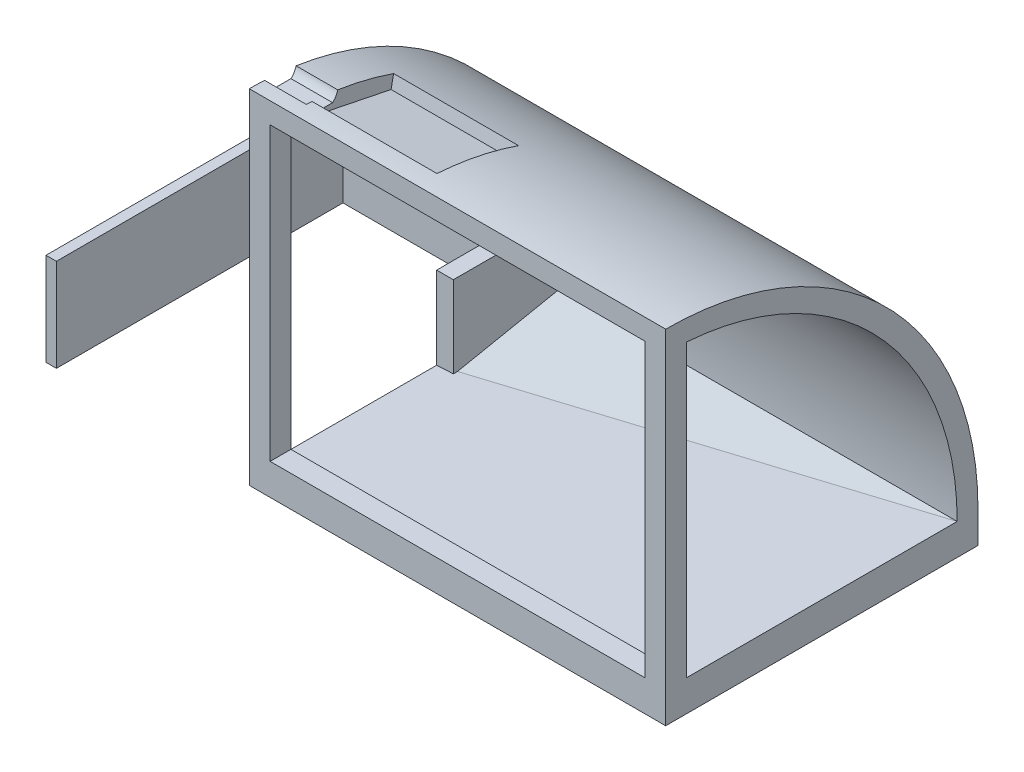
from build123d import *

# Parameters (mm, degrees)
SKETCH1_W                = 200
SKETCH1_H                = 150
BOSS_EXTRUDE1_DEPTH      = 15
SKETCH1_5_W              = 200
SKETCH1_5_H              = 10
REVOLVE1_ANGLE           = 90
BOSS_EXTRUDE3_REACH      = 197.256
BOSS_EXTRUDE3_END_RADIUS = 140
SKETCH1_6_W              = 10
SKETCH1_6_H              = 10
CUT_EXTRUDE2_DEPTH       = 60
CUT_EXTRUDE3_DEPTH       = 20
CUT_LOFT8_START          = -65
CUT_LOFT8_DEPTH          = 130
CUT_LOFT8_START_2        = -100
CUT_LOFT8_2_DEPTH        = 200
BOSS_EXTRUDE5_DEPTH      = 100
BOSS_EXTRUDE6_START      = -8
BOSS_EXTRUDE6_DEPTH      = 8
BOSS_EXTRUDE7_START      = -5
BOSS_EXTRUDE7_DEPTH      = 5


with BuildPart() as part:
    # Sketch1 → Boss-Extrude1 (new body)
    with BuildSketch(Plane(origin=(0, 0, 0), x_dir=(1, 0, 0), z_dir=(0, 1, 0))):
        Rectangle(SKETCH1_W, SKETCH1_H)
    extrude(amount=-BOSS_EXTRUDE1_DEPTH)

    # Sketch1<5> → Revolve1 (revolve)
    with BuildSketch(Plane(origin=(0, 0, 0), x_dir=(1, 0, 0), z_dir=(0, 1, 0))):
        with Locations((0, 70)):
            Rectangle(SKETCH1_5_W, SKETCH1_5_H)
    revolve(axis=Axis((-100, 0, 75), (1, 0, 0)), revolution_arc=REVOLVE1_ANGLE)

    # Boss-Extrude3: up to this cylinder (the profile starts inside it)
    boss_extrude3_end = Plane(origin=(0, 0, 75), z_dir=(-1, 0, 0)) * Cylinder(BOSS_EXTRUDE3_END_RADIUS, 865.512, mode=Mode.PRIVATE)
    # Sketch1<6> → Boss-Extrude3 (add, up to the surface)
    with BuildSketch(Plane(origin=(0, 0, 0), x_dir=(1, 0, 0), z_dir=(0, 1, 0)), mode=Mode.PRIVATE) as boss_extrude3_sk1:
        with Locations((-95, -70)):
            Rectangle(SKETCH1_6_W, SKETCH1_6_H)
    boss_extrude3_tool1 = extrude(boss_extrude3_sk1.sketch, amount=BOSS_EXTRUDE3_REACH, mode=Mode.PRIVATE) & boss_extrude3_end
    add(boss_extrude3_tool1.solids().sort_by_distance((-95, 0, 70))[0])
    # Sketch1<6> → Boss-Extrude3 (add, up to the surface)
    with BuildSketch(Plane(origin=(0, 0, 0), x_dir=(1, 0, 0), z_dir=(0, 1, 0)), mode=Mode.PRIVATE) as boss_extrude3_sk2:
        with Locations((95, -70)):
            Rectangle(SKETCH1_6_W, SKETCH1_6_H)
    boss_extrude3_tool2 = extrude(boss_extrude3_sk2.sketch, amount=BOSS_EXTRUDE3_REACH, mode=Mode.PRIVATE) & boss_extrude3_end
    add(boss_extrude3_tool2.solids().sort_by_distance((95, 0, 70))[0])

    # Sketch5 → Cut-Extrude2 (cut)
    with BuildSketch(Plane.ZY.offset(80)):
        Polygon((66.095917942, 143.620915339), (26.904082058, 135.620915339), (21.904082058, 160.115812766), (61.095917942, 168.115812766), align=None)
    extrude(amount=-CUT_EXTRUDE2_DEPTH, mode=Mode.SUBTRACT)

    # Sketch6 → Cut-Extrude3 (cut)
    with BuildSketch(Plane.ZY.offset(100)):
        with BuildLine():
            Line((55, 144.203533404), (65, 144.203533404))
            ThreePointArc((65, 144.203533404), (60, 157.655), (55, 144.203533404))
        make_face()
    extrude(amount=-CUT_EXTRUDE3_DEPTH, mode=Mode.SUBTRACT)

    # Cut-Loft8: read off the stored shape, not the designer's step
    # Cut-Loft8 outline → Cut-Loft8 (cut)
    with BuildSketch(Plane.XY.offset(CUT_LOFT8_START)):
        Polygon((-100, -10), (100, 0), (-100, 0), align=None)
    extrude(amount=CUT_LOFT8_DEPTH, mode=Mode.SUBTRACT)

    # Cut-Loft8 2 outline → Cut-Loft8 2 (add)
    with BuildSketch(Plane.YZ.offset(CUT_LOFT8_START_2)):
        Polygon((0, -65), (-10.4, -13), (-12, -13), (-12, -65), align=None)
    extrude(amount=CUT_LOFT8_2_DEPTH)

    # Sketch12 → Boss-Extrude5 (add)
    with BuildSketch(Plane.ZY.offset(100)):
        with BuildLine():
            Line((-65, -15), (-65, 0))
            ThreePointArc((-65, 0), (-64.208776017, 14.863266125), (-61.84404743, 29.558529783))
            Line((-61.84404743, 29.558529783), (-72.058809043, 29.558529783))
            ThreePointArc((-72.058809043, 29.558529783), (-74.262891163, 14.852249722), (-75, 0))
            Line((-75, 0), (-75, -15))
            Line((-75, -15), (-65, -15))
        make_face()
    extrude(amount=BOSS_EXTRUDE5_DEPTH)

    # Sketch12<4> → Boss-Extrude6 (add)
    with BuildSketch(Plane.ZY.offset(100).offset(BOSS_EXTRUDE6_START)):
        with BuildLine():
            Line((-65, 0), (-15, -10))
            Line((-15, -10), (-15, 29.558529783))
            Line((-15, 29.558529783), (-61.84404743, 29.558529783))
            ThreePointArc((-61.84404743, 29.558529783), (-64.208776017, 14.863266125), (-65, 0))
        make_face()
    extrude(amount=BOSS_EXTRUDE6_DEPTH)

    # Sketch21 → Boss-Extrude7 (add)
    with BuildSketch(Plane.ZY.offset(200).offset(BOSS_EXTRUDE7_START)):
        with BuildLine():
            Line((-61.84404743, 29.558529783), (72.644533384, 29.558529783))
            Line((72.644533384, 29.558529783), (72.644533384, -15))
            Line((72.644533384, -15), (-65, -15))
            Line((-65, -15), (-65, 0))
            ThreePointArc((-65, 0), (-64.208776017, 14.863266125), (-61.84404743, 29.558529783))
        make_face()
    extrude(amount=BOSS_EXTRUDE7_DEPTH)


solid = part.part
